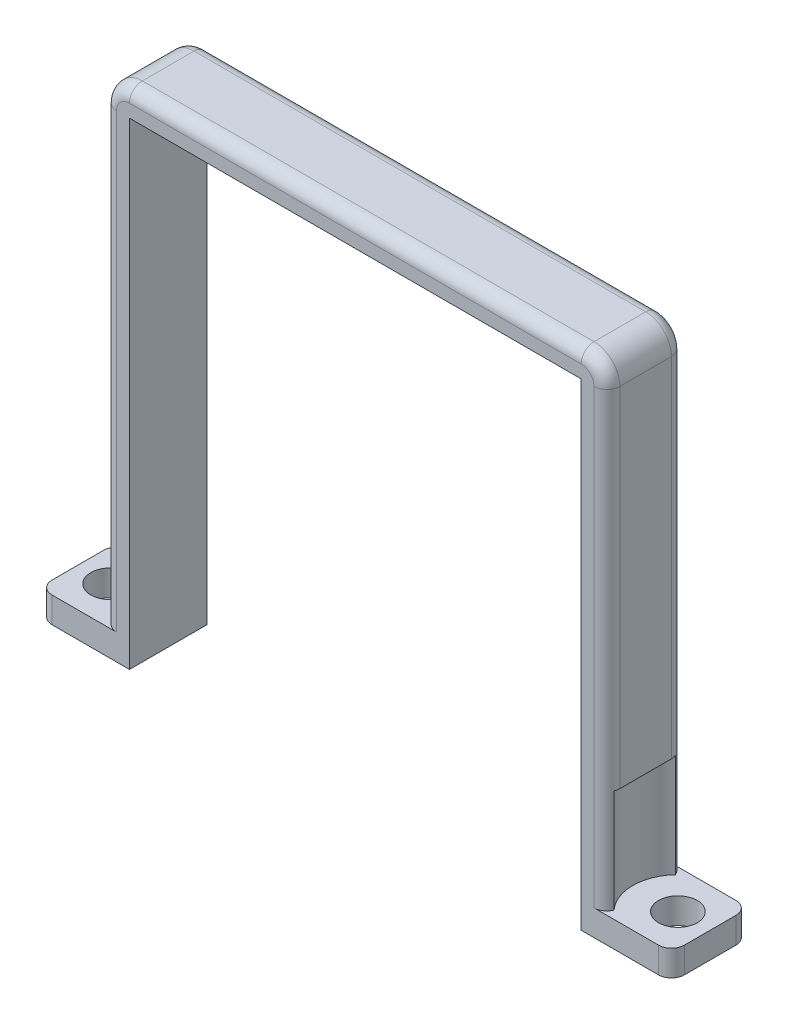
from build123d import *

# Parameters (mm, degrees)
BOSS_EXTRUDE1_DEPTH = 6
SKETCH2_R           = 1.5
CUT_EXTRUDE1_DEPTH  = 2
FILLET1_R           = 2
SKETCH3_R           = 3.5
CUT_EXTRUDE2_DEPTH  = 8
FILLET2_R           = 1


with BuildPart() as part:
    # Sketch1 → Boss-Extrude1 (new body)
    with BuildSketch(Plane.XY):
        Polygon((-24.5, 2), (-24.5, 0), (-17.5, 0), (-17.5, 37), (0, 37), (0, 39), (-19.5, 39), (-19.5, 2), align=None)
        Polygon((0, 39), (0, 37), (17.5, 37), (17.5, 0), (24.5, 0), (24.5, 2), (19.5, 2), (19.5, 39), align=None)
    extrude(amount=BOSS_EXTRUDE1_DEPTH)

    # Sketch2 → Cut-Extrude1 (cut)
    with BuildSketch(Plane(origin=(0, 2, 0), x_dir=(1, 0, 0), z_dir=(0, 1, 0))):
        with Locations(Location((-22, -3, 0), (0, 0, 180))):
            Circle(SKETCH2_R)
        with Locations((22, -3)):
            Circle(SKETCH2_R)
    extrude(amount=-CUT_EXTRUDE1_DEPTH, mode=Mode.SUBTRACT)

    # Fillet1
    fillet1_edges = [part.edges().sort_by_distance(p)[0] for p in [
        (-19.5, 39, 3),
        (19.5, 39, 3),
    ]]
    fillet(fillet1_edges, radius=FILLET1_R)

    # Sketch3 → Cut-Extrude2 (cut)
    with BuildSketch(Plane(origin=(0, 2, 0), x_dir=(1, 0, 0), z_dir=(0, 1, 0))):
        with Locations((-22, -3)):
            Circle(SKETCH3_R)
        with Locations((22, -3)):
            Circle(SKETCH3_R)
    extrude(amount=CUT_EXTRUDE2_DEPTH, mode=Mode.SUBTRACT)

    # Fillet2
    # the kernel refuses this fillet: 1 mm, written as the material it takes off along each edge
    with BuildSketch(Plane(origin=(19.5, 2, 0), x_dir=(0, 0, 1), z_dir=(0, 1, 0)), Plane(origin=(19.5, 2, 6), x_dir=(-1, 0, 0), z_dir=(0, 1, 0)), Plane(origin=(17.5, 39, 0), x_dir=(0, 0, 1), z_dir=(-1, 0, 0)), Plane(origin=(-17.5, 39, 6), x_dir=(0, 0, -1), z_dir=(1, 0, 0)), Plane(origin=(-19.5, 37, 6), x_dir=(1, 0, 0), z_dir=(0, -1, 0)), Plane(origin=(-19.5, 37, 0), x_dir=(0, 0, 1), z_dir=(0, -1, 0))) as fillet2_piece_1:
        with BuildLine():
            CenterArc((FILLET2_R, -FILLET2_R), FILLET2_R, 90, 90)
            Line((0, -FILLET2_R), (0, 0))
            Line((0, 0), (FILLET2_R, 0))
        make_face()
    extrude(amount=35, mode=Mode.SUBTRACT)
    with BuildSketch(Plane(origin=(17.5, 37, 6), x_dir=(0, 1, 0), z_dir=(-1, 0, 0))) as fillet2_piece_2:
        with BuildLine():
            CenterArc((2 - FILLET2_R, FILLET2_R), FILLET2_R, 270, 90)
            Line((2, FILLET2_R), (2, 0))
            Line((2, 0), (2 - FILLET2_R, 0))
        make_face()
    revolve(axis=Axis((17.5, 37, 6), (0, 0, -1)), revolution_arc=90, mode=Mode.SUBTRACT)
    with BuildSketch(Plane(origin=(17.5, 37, 0), x_dir=(0, 1, 0), z_dir=(-1, 0, 0))) as fillet2_piece_3:
        with BuildLine():
            CenterArc((2 - FILLET2_R, -FILLET2_R), FILLET2_R, 0, 90)
            Line((2 - FILLET2_R, 0), (2, 0))
            Line((2, 0), (2, -FILLET2_R))
        make_face()
    revolve(axis=Axis((17.5, 37, 0), (0, 0, -1)), revolution_arc=90, mode=Mode.SUBTRACT)
    with BuildSketch(Plane(origin=(-17.5, 37, 6), x_dir=(0, 1, 0), z_dir=(1, 0, 0))) as fillet2_piece_4:
        with BuildLine():
            CenterArc((2 - FILLET2_R, -FILLET2_R), FILLET2_R, 0, 90)
            Line((2, -FILLET2_R), (2, 0))
            Line((2, 0), (2 - FILLET2_R, 0))
        make_face()
    revolve(axis=Axis((-17.5, 37, 6), (0, 0, 1)), revolution_arc=90, mode=Mode.SUBTRACT)
    with BuildSketch(Plane(origin=(-17.5, 37, 0), x_dir=(0, 1, 0), z_dir=(1, 0, 0))) as fillet2_piece_5:
        with BuildLine():
            CenterArc((2 - FILLET2_R, FILLET2_R), FILLET2_R, 270, 90)
            Line((2 - FILLET2_R, 0), (2, 0))
            Line((2, 0), (2, FILLET2_R))
        make_face()
    revolve(axis=Axis((-17.5, 37, 0), (0, 0, 1)), revolution_arc=90, mode=Mode.SUBTRACT)
    with BuildSketch(Plane(origin=(24.5, -2.5, 0), x_dir=(0, 0, 1), z_dir=(0, 1, 0)), Plane(origin=(24.5, -2.5, 6), x_dir=(-1, 0, 0), z_dir=(0, 1, 0)), Plane(origin=(-24.5, 4.5, 0), x_dir=(0, 0, 1), z_dir=(0, -1, 0)), Plane(origin=(-24.5, 4.5, 6), x_dir=(1, 0, 0), z_dir=(0, -1, 0))) as fillet2_piece_6:
        with BuildLine():
            CenterArc((FILLET2_R, -FILLET2_R), FILLET2_R, 90, 90)
            Line((0, -FILLET2_R), (0, 0))
            Line((0, 0), (FILLET2_R, 0))
        make_face()
    extrude(amount=7, mode=Mode.SUBTRACT)


solid = part.part
